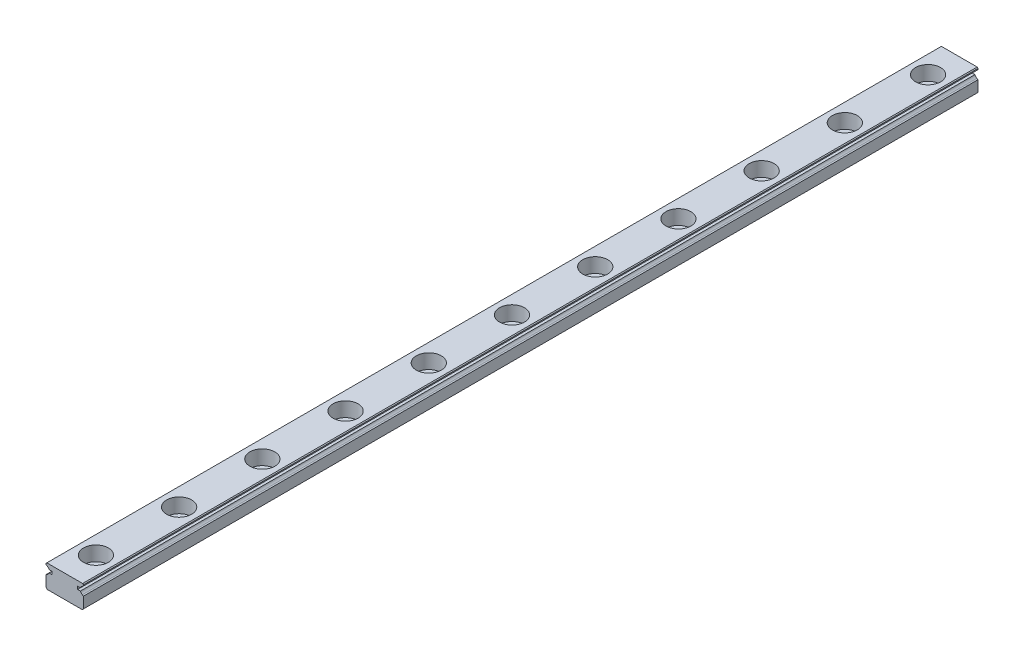
from build123d import *

# Parameters (mm, degrees)
BOSS_EXTRUDE1_DEPTH      = 107.5
BOSS_EXTRUDE1_DEPTH_BACK = 107.5


with BuildPart() as part:
    # Sketch1 → Boss-Extrude1 (new, two sides: drawn at the far end of the back side and taken through both)
    with BuildSketch(Plane.XY.offset(-BOSS_EXTRUDE1_DEPTH_BACK)):
        with BuildLine():
            Line((-4.5, 0.3), (-4.2, 0))
            Line((-4.2, 0), (4.2, 0))
            Line((4.2, 0), (4.5, 0.3))
            Line((4.5, 0.3), (4.5, 2.9566))
            Line((4.5, 2.9566), (4.221551301, 3.117342439))
            ThreePointArc((4.221551301, 3.117342439), (3.944156259, 3.345084602), (3.754838798, 3.65))
            Line((3.754838798, 3.65), (3.1, 3.65))
            Line((3.1, 3.65), (3.1, 4.35))
            Line((3.1, 4.35), (3.754838798, 4.35))
            ThreePointArc((3.754838798, 4.35), (3.944156259, 4.654915398), (4.221551301, 4.882657561))
            Line((4.221551301, 4.882657561), (4.5, 5.0434))
            Line((4.5, 5.0434), (4.5, 5.3))
            Line((4.5, 5.3), (4.3, 5.5))
            Line((4.3, 5.5), (-4.3, 5.5))
            Line((-4.3, 5.5), (-4.5, 5.3))
            Line((-4.5, 5.3), (-4.5, 5.0434))
            Line((-4.5, 5.0434), (-4.221551301, 4.882657561))
            ThreePointArc((-4.221551301, 4.882657561), (-3.944156259, 4.654915398), (-3.754838798, 4.35))
            Line((-3.754838798, 4.35), (-3.1, 4.35))
            Line((-3.1, 4.35), (-3.1, 3.65))
            Line((-3.1, 3.65), (-3.754838798, 3.65))
            ThreePointArc((-3.754838798, 3.65), (-3.944156259, 3.345084602), (-4.221551301, 3.117342439))
            Line((-4.221551301, 3.117342439), (-4.5, 2.9566))
            Line((-4.5, 2.9566), (-4.5, 0.3))
        make_face()
    extrude(amount=BOSS_EXTRUDE1_DEPTH + BOSS_EXTRUDE1_DEPTH_BACK)

    # Sketch2 → Cut-Revolve1 (revolve, cut)
    with BuildSketch(Plane(origin=(0, 0, 0), x_dir=(0, 0, -1), z_dir=(1, 0, 0))):
        Polygon((100, 5.5), (103, 5.5), (103, 2), (101.75, 2), (101.75, 0), (100, 0), align=None)
    revolve(axis=Axis((0, 0, -100), (0, 1, 0)), mode=Mode.SUBTRACT)

    # Sketch3 → Cut-Revolve2 (revolve, cut)
    with BuildSketch(Plane(origin=(0, 0, 0), x_dir=(0, 0, -1), z_dir=(1, 0, 0))):
        Polygon((80, 5.5), (83, 5.5), (83, 2), (81.75, 2), (81.75, 0), (80, 0), align=None)
    revolve(axis=Axis((0, 0, -80), (0, 1, 0)), mode=Mode.SUBTRACT)

    # Sketch4 → Cut-Revolve3 (revolve, cut)
    with BuildSketch(Plane(origin=(0, 0, 0), x_dir=(0, 0, -1), z_dir=(1, 0, 0))):
        Polygon((60, 5.5), (63, 5.5), (63, 2), (61.75, 2), (61.75, 0), (60, 0), align=None)
    revolve(axis=Axis((0, 0, -60), (0, 1, 0)), mode=Mode.SUBTRACT)

    # Sketch5 → Cut-Revolve4 (revolve, cut)
    with BuildSketch(Plane(origin=(0, 0, 0), x_dir=(0, 0, -1), z_dir=(1, 0, 0))):
        Polygon((40, 5.5), (43, 5.5), (43, 2), (41.75, 2), (41.75, 0), (40, 0), align=None)
    revolve(axis=Axis((0, 0, -40), (0, 1, 0)), mode=Mode.SUBTRACT)

    # Sketch6 → Cut-Revolve5 (revolve, cut)
    with BuildSketch(Plane(origin=(0, 0, 0), x_dir=(0, 0, -1), z_dir=(1, 0, 0))):
        Polygon((20, 5.5), (23, 5.5), (23, 2), (21.75, 2), (21.75, 0), (20, 0), align=None)
    revolve(axis=Axis((0, 0, -20), (0, 1, 0)), mode=Mode.SUBTRACT)

    # Sketch7 → Cut-Revolve6 (revolve, cut)
    with BuildSketch(Plane(origin=(0, 0, 0), x_dir=(0, 0, -1), z_dir=(1, 0, 0))):
        Polygon((0, 5.5), (3, 5.5), (3, 2), (1.75, 2), (1.75, 0), (0, 0), align=None)
    revolve(axis=Axis((0, 0, 0), (0, 1, 0)), mode=Mode.SUBTRACT)

    # Sketch8 → Cut-Revolve7 (revolve, cut)
    with BuildSketch(Plane(origin=(0, 0, 0), x_dir=(0, 0, -1), z_dir=(1, 0, 0))):
        Polygon((-20, 5.5), (-17, 5.5), (-17, 2), (-18.25, 2), (-18.25, 0), (-20, 0), align=None)
    revolve(axis=Axis((0, 0, 20), (0, 1, 0)), mode=Mode.SUBTRACT)

    # Sketch9 → Cut-Revolve8 (revolve, cut)
    with BuildSketch(Plane(origin=(0, 0, 0), x_dir=(0, 0, -1), z_dir=(1, 0, 0))):
        Polygon((-40, 5.5), (-37, 5.5), (-37, 2), (-38.25, 2), (-38.25, 0), (-40, 0), align=None)
    revolve(axis=Axis((0, 0, 40), (0, 1, 0)), mode=Mode.SUBTRACT)

    # Sketch10 → Cut-Revolve9 (revolve, cut)
    with BuildSketch(Plane(origin=(0, 0, 0), x_dir=(0, 0, -1), z_dir=(1, 0, 0))):
        Polygon((-60, 5.5), (-57, 5.5), (-57, 2), (-58.25, 2), (-58.25, 0), (-60, 0), align=None)
    revolve(axis=Axis((0, 0, 60), (0, 1, 0)), mode=Mode.SUBTRACT)

    # Sketch11 → Cut-Revolve10 (revolve, cut)
    with BuildSketch(Plane(origin=(0, 0, 0), x_dir=(0, 0, -1), z_dir=(1, 0, 0))):
        Polygon((-80, 5.5), (-77, 5.5), (-77, 2), (-78.25, 2), (-78.25, 0), (-80, 0), align=None)
    revolve(axis=Axis((0, 0, 80), (0, 1, 0)), mode=Mode.SUBTRACT)

    # Sketch12 → Cut-Revolve11 (revolve, cut)
    with BuildSketch(Plane(origin=(0, 0, 0), x_dir=(0, 0, -1), z_dir=(1, 0, 0))):
        Polygon((-100, 5.5), (-97, 5.5), (-97, 2), (-98.25, 2), (-98.25, 0), (-100, 0), align=None)
    revolve(axis=Axis((0, 0, 100), (0, 1, 0)), mode=Mode.SUBTRACT)


solid = part.part
